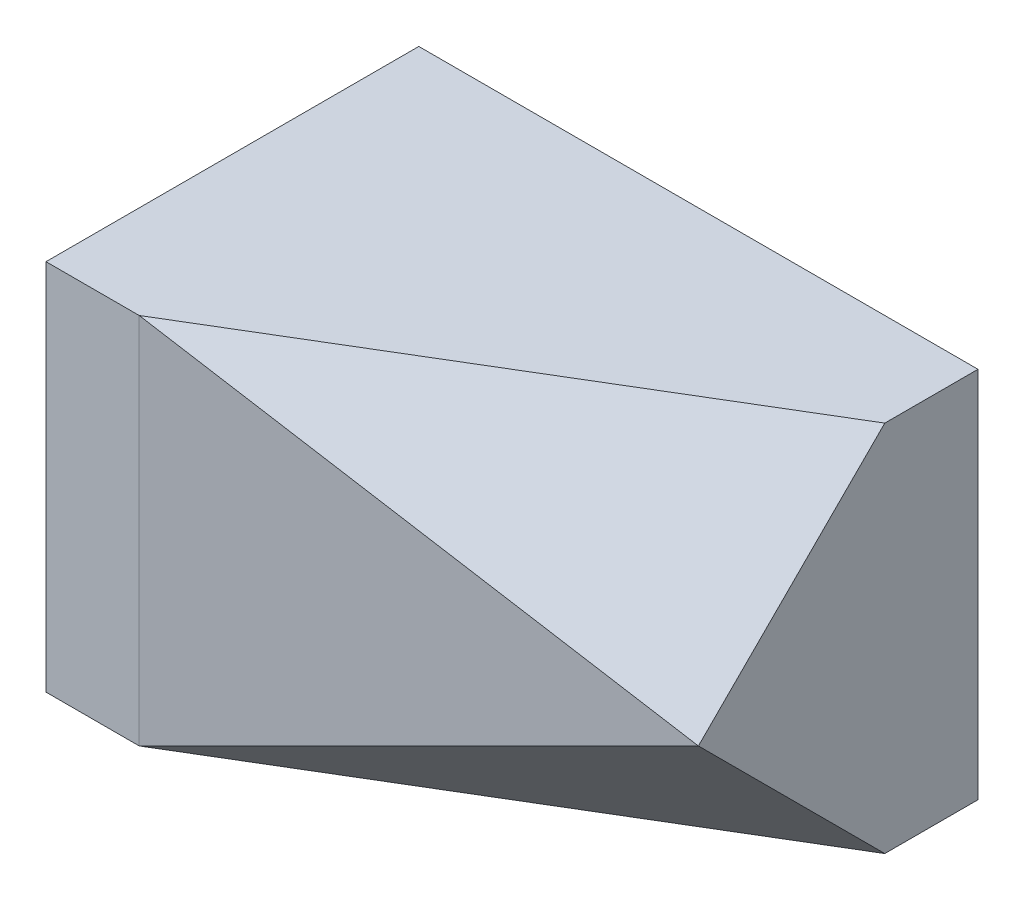
from build123d import *

# Parameters (mm, degrees)
SKETCH_1_W              = 60
SKETCH_1_H              = 40
EXTRUDE_1_DEPTH         = 40
CUT_EXTRUDE_1_DEPTH     = 54.851648071
CUT_EXTRUDE_START       = 31.245338635
CUT_EXTRUDE_2_OUTLINE_W = 57
CUT_EXTRUDE_2_OUTLINE_H = 31
CUT_EXTRUDE_2_DEPTH     = 13.018891098
CUT_EXTRUDE_START_2     = 5.207556439
CUT_EXTRUDE_3_OUTLINE_W = 57
CUT_EXTRUDE_3_OUTLINE_H = 32
CUT_EXTRUDE_3_DEPTH     = 13.018891098


# Read off the part's stored shape, not the designer's step: 除料-伸長2, 除料-伸長3
with BuildPart() as part:
    # 草圖1 → 填料-伸長1 (new body)
    with BuildSketch(Plane(origin=(0, 0, 0), x_dir=(1, 0, 0), z_dir=(0, 1, 0))):
        Rectangle(SKETCH_1_W, SKETCH_1_H)
    extrude(amount=EXTRUDE_1_DEPTH)

    # 草圖2 → 除料-伸長1 (cut, through all)
    with BuildSketch(Plane(origin=(0, 40, 0), x_dir=(1, 0, 0), z_dir=(0, 1, 0))):
        Polygon((-20, -20), (30, -10), (30, -20), align=None)
    extrude(amount=-CUT_EXTRUDE_1_DEPTH, mode=Mode.SUBTRACT)

    # 除料-伸長2 outline → 除料-伸長2 (cut)
    with BuildSketch(Plane(origin=(0, 0, 0), x_dir=(0.9205746178983231, -0.27617238536949745, -0.27617238536949745), z_dir=(0.3905667329424722, 0.6509445549041193, 0.6509445549041193)).offset(CUT_EXTRUDE_START)):
        with Locations((-7.5, 21.5)):
            Rectangle(CUT_EXTRUDE_2_OUTLINE_W, CUT_EXTRUDE_2_OUTLINE_H)
    extrude(amount=CUT_EXTRUDE_2_DEPTH, mode=Mode.SUBTRACT)

    # 除料-伸長3 outline → 除料-伸長3 (cut)
    with BuildSketch(Plane(origin=(0, 0, 0), x_dir=(0.9205746178983235, 0.27617238536949645, -0.2761723853694968), z_dir=(0.3905667329424711, -0.6509445549041191, 0.65094455490412)).offset(CUT_EXTRUDE_START_2)):
        with Locations((3.5, 7)):
            Rectangle(CUT_EXTRUDE_3_OUTLINE_W, CUT_EXTRUDE_3_OUTLINE_H)
    extrude(amount=CUT_EXTRUDE_3_DEPTH, mode=Mode.SUBTRACT)


solid = part.part
